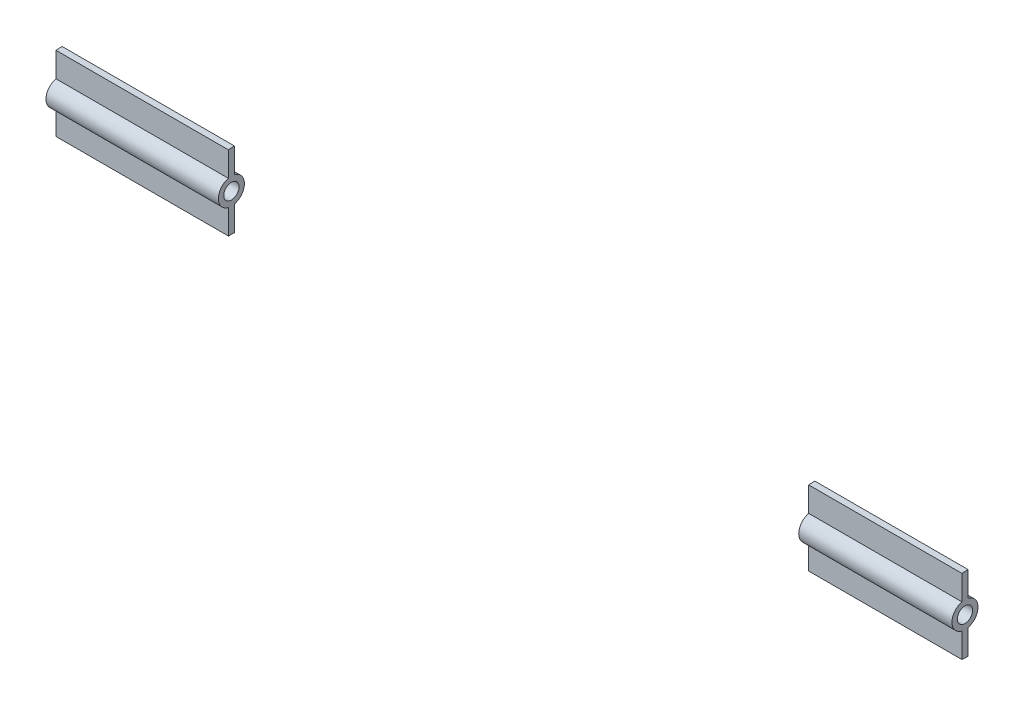
from build123d import *

# Parameters (mm, degrees)
SKETCH4_4_R         = 2
BOSS_EXTRUDE3_DEPTH = 40
BOSS_EXTRUDE4_START = -45
SKETCH9_3_R         = 2
BOSS_EXTRUDE4_DEPTH = 45


with BuildPart() as part:
    # Sketch4<4> → Boss-Extrude3 (new body)
    with BuildSketch(Plane(origin=(236.5, 0, 0), x_dir=(0, 0, -1), z_dir=(1, 0, 0))):
        with BuildLine():
            Line((-117.799963298, 9.743799031), (-117.799963298, 3.304542328))
            ThreePointArc((-117.799963298, 3.304542328), (-120.399963298, 0), (-117.799963298, -3.304542328))
            Line((-117.799963298, -3.304542328), (-117.799963298, -9.743799031))
            Line((-117.799963298, -9.743799031), (-116.199963298, -9.811394623))
            Line((-116.199963298, -9.811394623), (-116.199963298, -3.304542328))
            ThreePointArc((-116.199963298, -3.304542328), (-113.599963298, 0), (-116.199963298, 3.304542328))
            Line((-116.199963298, 3.304542328), (-116.199963298, 9.811394623))
            Line((-116.199963298, 9.811394623), (-117.799963298, 9.743799031))
        make_face()
        with Locations((-116.999963298, 0)):
            Circle(SKETCH4_4_R, mode=Mode.SUBTRACT)
    extrude(amount=-BOSS_EXTRUDE3_DEPTH)


with BuildPart() as body_2:
    # Sketch9<3> → Boss-Extrude4 (new body)
    with BuildSketch(Plane.ZY.offset(BOSS_EXTRUDE4_START)):
        with BuildLine():
            Line((117.799963298, 9.743953218), (116.199963298, 9.81153837))
            Line((116.199963298, 9.81153837), (116.199963298, 3.304542328))
            ThreePointArc((116.199963298, 3.304542328), (113.599963298, 0), (116.199963298, -3.304542328))
            Line((116.199963298, -3.304542328), (116.199963298, -9.811382599))
            Line((116.199963298, -9.811382599), (117.799963298, -9.74378798))
            Line((117.799963298, -9.74378798), (117.799963298, -3.304542328))
            ThreePointArc((117.799963298, -3.304542328), (120.399963298, 0), (117.799963298, 3.304542328))
            Line((117.799963298, 3.304542328), (117.799963298, 9.743953218))
        make_face()
        with Locations((116.999963298, 0)):
            Circle(SKETCH9_3_R, mode=Mode.SUBTRACT)
    extrude(amount=BOSS_EXTRUDE4_DEPTH)


solid = Compound([part.part, body_2.part])
